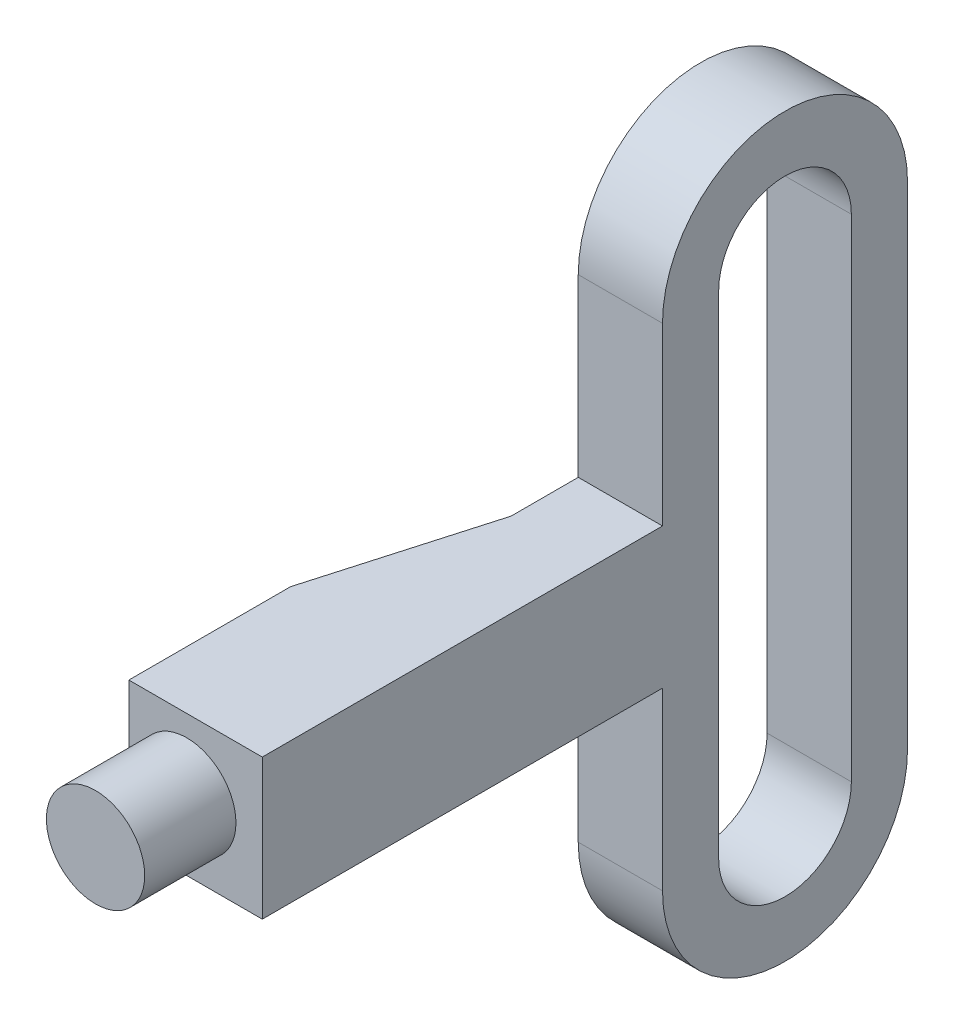
from build123d import *

# Parameters (mm, degrees)
BOSS_EXTRUDE2_DEPTH = 24.13
SKETCH3_W           = 24.13
SKETCH3_H           = 25.4
SKETCH3_R           = 8.89
CUT_EXTRUDE3_DEPTH  = 16.51
SKETCH4_W           = 138.37052371
SKETCH4_H           = 157.28988693
CUT_EXTRUDE4_DEPTH  = 8.89
CHAMFER1_SIZE       = 34.874144438
CHAMFER1_SIZE_2     = 10


with BuildPart() as part:
    # Sketch2 → Boss-Extrude2 (new body)
    # profile 1 of 2: a face of its own
    with BuildSketch(Plane(origin=(0, 0, 0), x_dir=(0, 0, -1), z_dir=(1, 0, 0))):
        Polygon((-111.06, -12.7), (-22.16, -12.7), (-22.16, 0), (-22.16, 12.7), (-111.06, 12.7), align=None)
    # profile 2 of 2: a face of its own
    with BuildSketch(Plane(origin=(0, 0, 0), x_dir=(0, 0, -1), z_dir=(1, 0, 0))):
        with BuildLine():
            Line((-22.16, -44.45), (-22.16, 44.45))
            ThreePointArc((-22.16, 44.45), (0, 66.61), (22.16, 44.45))
            Line((22.16, 44.45), (22.16, -44.45))
            ThreePointArc((22.16, -44.45), (0, -66.61), (-22.16, -44.45))
        make_face()
        with BuildLine():
            ThreePointArc((12, 44.45), (0, 56.45), (-12, 44.45))
            Line((-12, 44.45), (-12, -44.45))
            ThreePointArc((-12, -44.45), (0, -56.45), (12, -44.45))
            Line((12, -44.45), (12, 44.45))
        make_face(mode=Mode.SUBTRACT)
    extrude(amount=BOSS_EXTRUDE2_DEPTH)

    # Sketch3 → Cut-Extrude3 (cut)
    with BuildSketch(Plane.XY.offset(111.06)):
        with Locations((12.065, 0)):
            Rectangle(SKETCH3_W, SKETCH3_H)
        with Locations((10.4775, 0)):
            Circle(SKETCH3_R, mode=Mode.SUBTRACT)
    extrude(amount=-CUT_EXTRUDE3_DEPTH, mode=Mode.SUBTRACT)

    # Sketch4 → Cut-Extrude4 (cut)
    with BuildSketch(Plane.ZY):
        Rectangle(SKETCH4_W, SKETCH4_H)
    extrude(amount=-CUT_EXTRUDE4_DEPTH, mode=Mode.SUBTRACT)

    # Chamfer1
    # the kernel refuses this chamfer: 34.874144438, 10 mm, written as the material it adds along each edge
    with BuildSketch(Plane(origin=(8.89, 12.7, 69.185261855), x_dir=(0.010616657410321159, 0, -0.9999436417045873), z_dir=(0, -1, 0))) as chamfer1_piece_1_section:
        Polygon((CHAMFER1_SIZE * 0.999943641716, -CHAMFER1_SIZE * 0.0106166574104), (-CHAMFER1_SIZE_2 * 0.0106166574103, -CHAMFER1_SIZE_2 * 0.999943641705), (0, 0), align=None)
    chamfer1_piece_1 = extrude(amount=25.4, mode=Mode.PRIVATE)
    chamfer1_piece_1 = split(chamfer1_piece_1, bisect_by=Plane(origin=(0, 0, 56.832486902), z_dir=(1, 0, 0)), keep=Keep.TOP, mode=Mode.PRIVATE)
    add(chamfer1_piece_1)


solid = part.part
